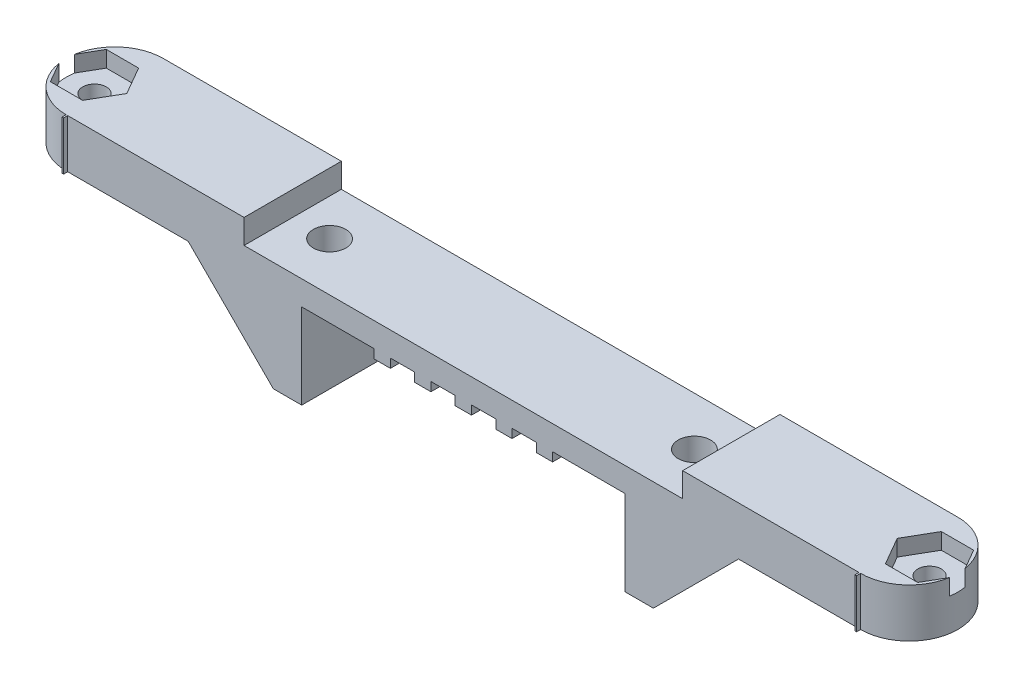
from build123d import *

# Parameters (mm, degrees)
SKETCH1_R                 = 1.45
BOSS_EXTRUDE1_DEPTH       = 3
SKETCH4_W                 = 3.5
SKETCH4_H                 = 12
BOSS_EXTRUDE3_DEPTH       = 10.5
SKETCH5_W                 = 2
SKETCH5_H                 = 12
BOSS_EXTRUDE4_DEPTH       = 1.1
SKETCH6_W                 = 0.2
SKETCH6_H                 = 3
BOSS_EXTRUDE5_DEPTH       = 0.5
CHAMFER1_SIZE             = 10.5
F_3_0MM_DOWEL_HOLE1_D     = 2.9
F_3_0MM_DOWEL_HOLE1_DEPTH = 13.5
SKETCH10_R                = 1.45
BOSS_EXTRUDE6_DEPTH       = 3
CUT_EXTRUDE1_START        = -2
SKETCH11_R                = 1.45
CUT_EXTRUDE1_DEPTH        = 2
SKETCH12_R                = 2
CUT_EXTRUDE2_DEPTH        = 8


with BuildPart() as part:
    # Sketch1 → Boss-Extrude1 (new body)
    with BuildSketch(Plane(origin=(0, 0, 0), x_dir=(1, 0, 0), z_dir=(0, 1, 0))):
        with BuildLine():
            Line((-49, 6), (49, 6))
            ThreePointArc((49, 6), (55, 0), (49, -6))
            Line((49, -6), (-49, -6))
            ThreePointArc((-49, -6), (-55, 0), (-49, 6))
        make_face()
        with Locations(Location((-51.5, 0, 0), (0, 0, 270))):
            Circle(SKETCH1_R, mode=Mode.SUBTRACT)
        with Locations(Location((51.5, 0, 0), (0, 0, 270))):
            Circle(SKETCH1_R, mode=Mode.SUBTRACT)
    extrude(amount=BOSS_EXTRUDE1_DEPTH)

    # Sketch4 → Boss-Extrude3 (add)
    with BuildSketch(Plane.XZ):
        with Locations((-21.690023983, 0)):
            Rectangle(SKETCH4_W, SKETCH4_H)
        with Locations((21.690023983, 0)):
            Rectangle(SKETCH4_W, SKETCH4_H)
    extrude(amount=BOSS_EXTRUDE3_DEPTH)

    # Sketch5 → Boss-Extrude4 (add)
    with BuildSketch(Plane.XZ):
        with Locations((5, 0)):
            Rectangle(SKETCH5_W, SKETCH5_H)
        Rectangle(SKETCH5_W, SKETCH5_H)
        with Locations((10, 0)):
            Rectangle(SKETCH5_W, SKETCH5_H)
        with Locations((-5, 0)):
            Rectangle(SKETCH5_W, SKETCH5_H)
        with Locations((-10, 0)):
            Rectangle(SKETCH5_W, SKETCH5_H)
    extrude(amount=BOSS_EXTRUDE4_DEPTH)

    # Sketch6 → Boss-Extrude5 (add)
    with BuildSketch(Plane.XY.offset(6)):
        with Locations((48.9, 1.5)):
            Rectangle(SKETCH6_W, SKETCH6_H)
        with Locations((-48.9, 1.5)):
            Rectangle(SKETCH6_W, SKETCH6_H)
    extrude(amount=BOSS_EXTRUDE5_DEPTH)

    # Chamfer1
    chamfer1_edges = [part.edges().sort_by_distance(p)[0] for p in [
        (-23.440023983, 0, 0),
        (23.440023983, 0, 0),
    ]]
    chamfer(chamfer1_edges, length=CHAMFER1_SIZE - 0.0001)  # a hair under: the kernel refuses the full size

    # Ø3.0mm Dowel Hole1
    with Locations(Plane(origin=(0, 3, 0), x_dir=(1, 0, 0), z_dir=(0, 1, 0))):
        with Locations((-51.5, 0), (51.5, 0)):
            Hole(F_3_0MM_DOWEL_HOLE1_D / 2, depth=F_3_0MM_DOWEL_HOLE1_DEPTH)

    # Sketch10 → Boss-Extrude6 (add)
    # profile 1 of 2: a face of its own
    with BuildSketch(Plane(origin=(0, 3, 0), x_dir=(1, 0, 0), z_dir=(0, 1, 0))):
        with BuildLine():
            Line((-48.8, -6), (-27.05, -6))
            Line((-27.05, -6), (-27.05, 6))
            Line((-27.05, 6), (-49, 6))
            ThreePointArc((-49, 6), (-55, 0), (-49, -6))
            Line((-49, -6), (-49, -6.5))
            Line((-49, -6.5), (-48.8, -6.5))
            Line((-48.8, -6.5), (-48.8, -6))
        make_face()
        with Locations(Location((-51.5, 0, 0), (0, 0, 270.000000001))):
            Circle(SKETCH10_R, mode=Mode.SUBTRACT)
    # profile 2 of 2: a face of its own
    with BuildSketch(Plane(origin=(0, 3, 0), x_dir=(1, 0, 0), z_dir=(0, 1, 0))):
        with BuildLine():
            Line((27.05, 6), (27.05, -6))
            Line((27.05, -6), (48.8, -6))
            Line((48.8, -6), (48.8, -6.5))
            Line((48.8, -6.5), (49, -6.5))
            Line((49, -6.5), (49, -6))
            ThreePointArc((49, -6), (55, 0), (49, 6))
            Line((49, 6), (27.05, 6))
        make_face()
        with Locations(Location((51.5, 0, 0), (0, 0, 270))):
            Circle(SKETCH10_R, mode=Mode.SUBTRACT)
    extrude(amount=BOSS_EXTRUDE6_DEPTH)

    # Sketch11 → Cut-Extrude1 (cut)
    # profile 1 of 2: a face of its own
    with BuildSketch(Plane(origin=(0, 6, 0), x_dir=(1, 0, 0), z_dir=(0, 1, 0)).offset(CUT_EXTRUDE1_START)):
        Polygon((53.491858429, 3.45), (55.483716857, 0), (53.491858429, -3.45), (49.508141571, -3.45), (47.516283143, 0), (49.508141571, 3.45), align=None)
    # profile 2 of 2: a face of its own
    with BuildSketch(Plane(origin=(0, 6, 0), x_dir=(1, 0, 0), z_dir=(0, 1, 0)).offset(CUT_EXTRUDE1_START)):
        Polygon((-47.516283143, 0), (-49.508141571, 3.45), (-53.491858429, 3.45), (-55.483716857, 0), (-53.491858429, -3.45), (-49.508141571, -3.45), align=None)
        with Locations(Location((-51.5, 0, 0), (0, 0, 270.000000001))):
            Circle(SKETCH11_R, mode=Mode.SUBTRACT)
    extrude(amount=CUT_EXTRUDE1_DEPTH, mode=Mode.SUBTRACT)

    # Sketch12 → Cut-Extrude2 (cut)
    with BuildSketch(Plane(origin=(0, 3, 0), x_dir=(1, 0, 0), z_dir=(0, 1, 0))):
        with Locations(Location((-22.5, 0, 0), (0, 0, 270))):
            Circle(SKETCH12_R)
        with Locations(Location((22.5, 0, 0), (0, 0, 270))):
            Circle(SKETCH12_R)
    extrude(amount=-CUT_EXTRUDE2_DEPTH, mode=Mode.SUBTRACT)


solid = part.part
